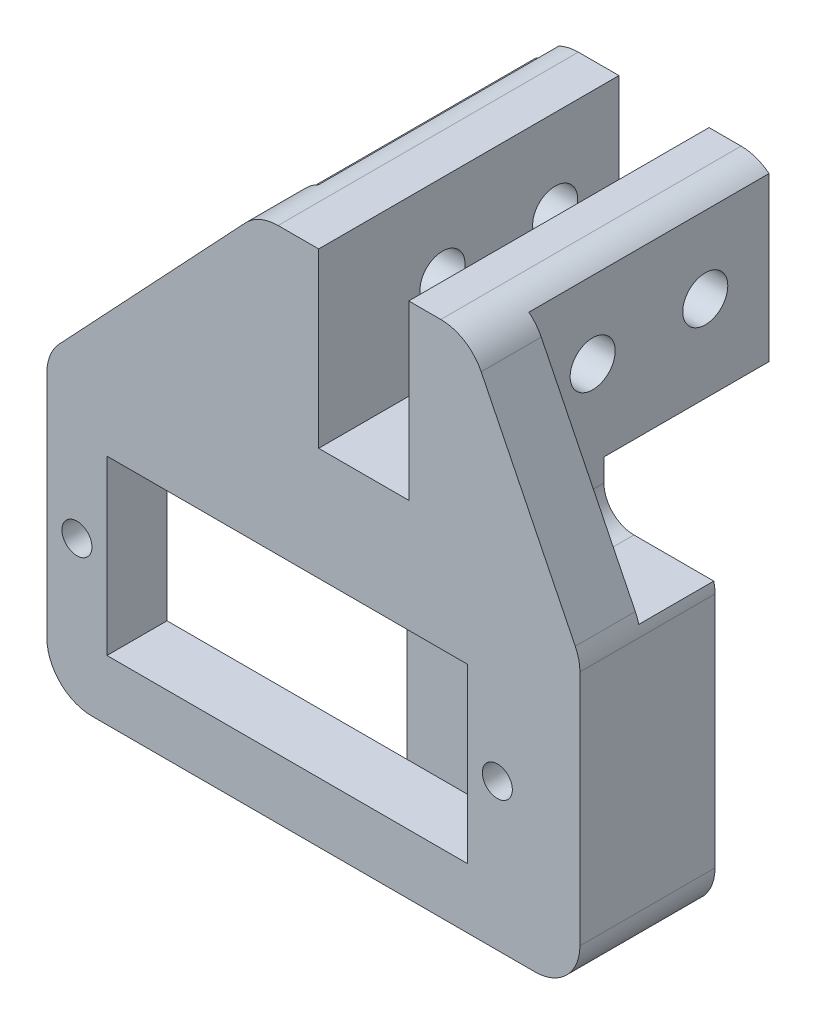
from build123d import *

# Parameters (mm, degrees)
SKETCH_1_W          = 32
SKETCH_1_H          = 19.5
SKETCH_1_R          = 1
SKETCH_1_W_2        = 24
SKETCH_1_H_2        = 11.5
SKETCH_1_W_3        = 3.5
EXTRUDE_1_DEPTH     = 4
SKETCH_4_W          = 3
SKETCH_4_H          = 3.5
EXTRUDE_3_DEPTH     = 4
FILLET_2_R          = 3
SKETCH_9_R          = 1.4
EXTRUDE_5_DEPTH     = 5
EXTRUDE_START       = 16
EXTRUDE_6_DEPTH     = 16
SKETCH_12_R         = 2.4
SKETCH_12_R_2       = 1.4
EXTRUDE_7_DEPTH     = 0.75
CHAMFER_4_SIZE      = 0.75
SKETCH_11_R         = 1.5
SKETCH_11_W         = 11
SKETCH_11_H         = 3.5
CUT_EXTRUDE_2_DEPTH = 41.720664287
FILLET_7_R          = 2
CUT_EXTRUDE_START   = -1.5
SKETCH_13_R         = 1.5
CUT_EXTRUDE_4_DEPTH = 1.5
SKETCH_15_W         = 16
SKETCH_15_H         = 8.062177826
EXTRUDE_9_DEPTH     = 1.5
FILLET_8_R          = 1.5


# Some blends are built 0.0001 mm under size
with BuildPart() as part:
    # Эскиз1 → Бобышка-Вытянуть1 (new body)
    # profile 1 of 2: a face of its own
    with BuildSketch(Plane.XY):
        Rectangle(SKETCH_1_W, SKETCH_1_H)
        with Locations((-14, 0)):
            Circle(SKETCH_1_R, mode=Mode.SUBTRACT)
        with Locations((14, 0)):
            Circle(SKETCH_1_R, mode=Mode.SUBTRACT)
        Rectangle(SKETCH_1_W_2, SKETCH_1_H_2, mode=Mode.SUBTRACT)
    # profile 2 of 2: a face of its own
    with BuildSketch(Plane.XY):
        with Locations((17.75, 0)):
            Rectangle(SKETCH_1_W_3, SKETCH_1_H)
    extrude(amount=EXTRUDE_1_DEPTH)

    # Эскиз4 → Бобышка-Вытянуть3 (add)
    with BuildSketch(Plane.XY.offset(4)):
        Polygon((-16, 9.75), (-1.9, 9.75), (-1.9, 24.75), align=None)
        Polygon((-1.9, 9.75), (2.1, 9.75), (2.1, 13.25), (2.1, 24.75), (-1.9, 24.75), align=None)
        Polygon((8.1, 13.25), (8.1, 9.75), (12.1, 9.75), (12.1, 24.75), (8.1, 24.75), align=None)
        Polygon((12.1, 24.75), (12.1, 9.75), (19.5, 9.75), align=None)
        with Locations((3.6, 11.5)):
            Rectangle(SKETCH_4_W, SKETCH_4_H)
        with Locations((6.6, 11.5)):
            Rectangle(SKETCH_4_W, SKETCH_4_H)
    extrude(amount=-EXTRUDE_3_DEPTH)

    # Скругление2
    fillet_2_edges = [part.edges().sort_by_distance(p)[0] for p in [
        (-16, 9.75, 2),
        (19.5, 9.75, 2),
        (19.5, -9.75, 2),
        (-16, -9.75, 2),
        (-1.9, 24.75, 2),
        (12.1, 24.75, 2),
    ]]
    fillet(fillet_2_edges, radius=FILLET_2_R)

    # Эскиз9 → Бобышка-Вытянуть5 (add)
    with BuildSketch(Plane(origin=(0, 0, 0), x_dir=(-1, 0, 0), z_dir=(0, 0, -1))):
        with BuildLine():
            ThreePointArc((-19.5, -6.75), (-18.621320344, -8.871320344), (-16.5, -9.75))
            Line((-16.5, -9.75), (-4, -9.75))
            Line((-4, -9.75), (-4, 5.75))
            Line((-4, 5.75), (1.9, 5.75))
            Line((1.9, 5.75), (1.9, 9.75))
            Line((1.9, 9.75), (-19.417252583, 9.75))
            ThreePointArc((-19.417252583, 9.75), (-19.479241325, 9.402567354), (-19.5, 9.050259072))
            Line((-19.5, 9.050259072), (-19.5, -6.75))
        make_face()
        with Locations(Location((-16.35, 0, 0), (0, 0, 9.875627991))):
            Circle(SKETCH_9_R, mode=Mode.SUBTRACT)
    extrude(amount=EXTRUDE_5_DEPTH)

    # Эскиз10 → Бобышка-Вытянуть6 (add)
    with BuildSketch(Plane(origin=(0, 0, 0), x_dir=(-1, 0, 0), z_dir=(0, 0, -1)).offset(EXTRUDE_START)):
        with BuildLine():
            Line((-8.1, 24.75), (-10.234794476, 24.75))
            ThreePointArc((-10.234794476, 24.75), (-11.222456407, 24.582759063), (-12.1, 24.099682607))
            Line((-12.1, 24.099682607), (-12.1, 9.75))
            Line((-12.1, 9.75), (1.9, 9.75))
            Line((1.9, 9.75), (1.9, 24.454983709))
            ThreePointArc((1.9, 24.454983709), (1.267895871, 24.675316319), (0.602670769, 24.75))
            Line((0.602670769, 24.75), (-2.1, 24.75))
            Line((-2.1, 24.75), (-2.1, 13.25))
            Line((-2.1, 13.25), (-8.1, 13.25))
            Line((-8.1, 13.25), (-8.1, 24.75))
        make_face()
    extrude(amount=-EXTRUDE_6_DEPTH)

    # Эскиз12 → Бобышка-Вытянуть7 (add)
    with BuildSketch(Plane(origin=(0, 0, -5), x_dir=(-1, 0, 0), z_dir=(0, 0, -1))):
        with Locations((-16.35, 0)):
            Circle(SKETCH_12_R)
        with Locations(Location((-16.35, 0, 0), (0, 0, 9.875627991))):
            Circle(SKETCH_12_R_2, mode=Mode.SUBTRACT)
    extrude(amount=EXTRUDE_7_DEPTH)

    # Фаска4
    chamfer_4_edges = [part.edges().sort_by_distance(p)[0] for p in [
        (18.75, 0, -5),
    ]]
    chamfer(chamfer_4_edges, length=CHAMFER_4_SIZE - 0.0001)  # a hair under: the kernel refuses the full size

    # Эскиз11 → Вырез-Вытянуть2 (cut, through all)
    with BuildSketch(Plane(origin=(12.1, 0, 0), x_dir=(0, 0, -1), z_dir=(1, 0, 0))):
        with Locations((4.25, 19)):
            Circle(SKETCH_11_R)
        with Locations((11.75, 19)):
            Circle(SKETCH_11_R)
        with Locations((10.5, 11.5)):
            Rectangle(SKETCH_11_W, SKETCH_11_H)
    extrude(amount=-CUT_EXTRUDE_2_DEPTH, mode=Mode.SUBTRACT)

    # Скругление7
    fillet_7_edges = [part.edges().sort_by_distance(p)[0] for p in [
        (4, -9.75, -2.5),
        (4, 5.75, -2.5),
        (-1.9, 5.75, -2.5),
        (12.1, 9.75, -2.5),
    ]]
    fillet(fillet_7_edges, radius=FILLET_7_R)

    # Эскиз13 → Вырез-Вытянуть4 (cut)
    # profile 1 of 2: a face of its own
    with BuildSketch(Plane.ZY.offset(1.9).offset(CUT_EXTRUDE_START)):
        Polygon((-11.75, 15.968911087), (-9.125, 17.484455543), (-9.125, 20.515544457), (-11.75, 22.031088913), (-14.375, 20.515544457), (-14.375, 17.484455543), align=None)
        with Locations(Location((-11.75, 19, 0), (0, 0, 90))):
            Circle(SKETCH_13_R, mode=Mode.SUBTRACT)
    # profile 2 of 2: a face of its own
    with BuildSketch(Plane.ZY.offset(1.9).offset(CUT_EXTRUDE_START)):
        Polygon((-1.625, 17.484455543), (-1.625, 20.515544457), (-4.25, 22.031088913), (-6.875, 20.515544457), (-6.875, 17.484455543), (-4.25, 15.968911087), align=None)
        with Locations(Location((-4.25, 19, 0), (0, 0, 90))):
            Circle(SKETCH_13_R, mode=Mode.SUBTRACT)
    extrude(amount=CUT_EXTRUDE_4_DEPTH, mode=Mode.SUBTRACT)

    # Эскиз15 → Бобышка-Вытянуть9 (add)
    with BuildSketch(Plane.ZY.offset(1.9)):
        with Locations((-8, 19)):
            Rectangle(SKETCH_15_W, SKETCH_15_H)
        Polygon((-9.125, 20.515544457), (-11.75, 22.031088913), (-14.375, 20.515544457), (-14.375, 17.484455543), (-11.75, 15.968911087), (-9.125, 17.484455543), align=None, mode=Mode.SUBTRACT)
        Polygon((-1.625, 17.484455543), (-1.625, 20.515544457), (-4.25, 22.031088913), (-6.875, 20.515544457), (-6.875, 17.484455543), (-4.25, 15.968911087), align=None, mode=Mode.SUBTRACT)
    extrude(amount=EXTRUDE_9_DEPTH)

    # Скругление8
    # the kernel refuses this fillet: 1.5 mm, written as the material it adds along each edge
    with BuildSketch(Plane(origin=(-1.9, 14.968911087, -16), x_dir=(-1, 0, 0), z_dir=(0, 0, 1))) as fillet_8_piece_1:
        with BuildLine():
            CenterArc((FILLET_8_R, FILLET_8_R), FILLET_8_R, 180, 90)
            Line((0, FILLET_8_R), (-FILLET_8_R * 0.02, FILLET_8_R))
            Line((-FILLET_8_R * 0.02, FILLET_8_R), (-FILLET_8_R * 0.02, -FILLET_8_R * 0.02))
            Line((-FILLET_8_R * 0.02, -FILLET_8_R * 0.02), (FILLET_8_R, -FILLET_8_R * 0.02))
            Line((FILLET_8_R, -FILLET_8_R * 0.02), (FILLET_8_R, 0))
        make_face()
    extrude(amount=19.75)
    with BuildSketch(Plane(origin=(-1.9, 23.031088913, 3.745170221), x_dir=(0, 1, 0), z_dir=(0, 0, -1))) as fillet_8_piece_2:
        with BuildLine():
            CenterArc((1.5, -1.498068089), FILLET_8_R, 92.908253333, 87.091746667)
            Line((0, -1.498068089), (-0.03, -1.498068089))
            Line((-0.03, -1.498068089), (-0.03, 0))
            Line((-0.03, 0), (0, 0.03))
            ThreePointArc((0, 0.03), (0.711947398, 0.03), (1.422372692, 0.029961362))
            Line((1.422372692, 0.029961362), (1.423894796, 0))
        make_face()
    extrude(amount=19.745170221)


solid = part.part
